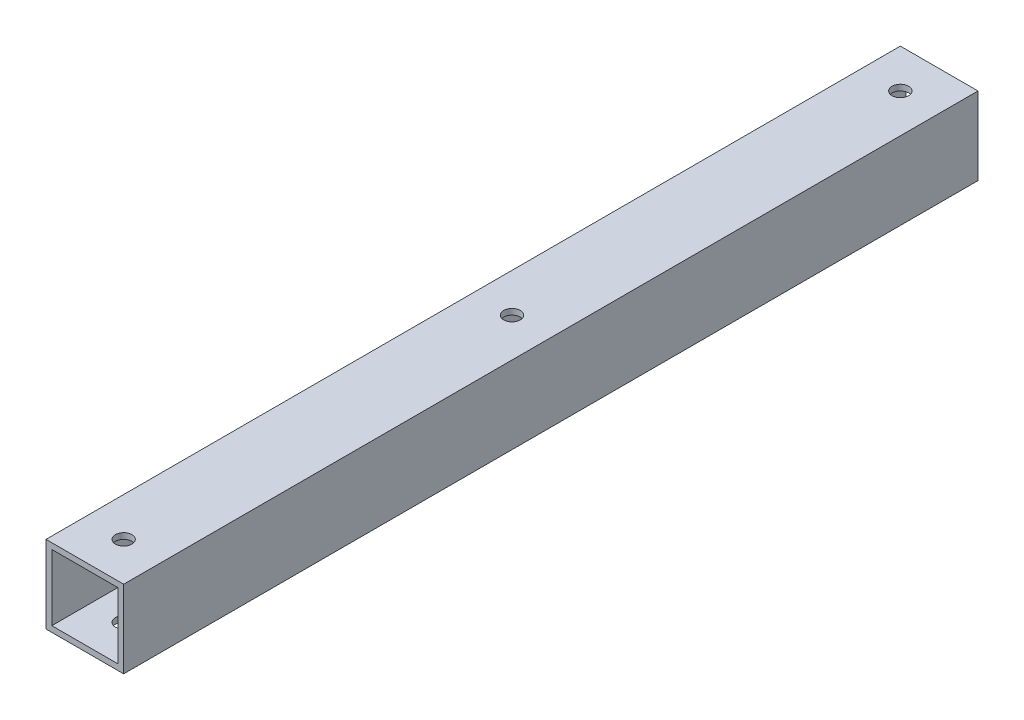
from build123d import *

# Parameters (mm, degrees)
SKETCH1_W           = 20
SKETCH1_H           = 20
SKETCH1_W_2         = 17
SKETCH1_H_2         = 17
BOSS_EXTRUDE1_DEPTH = 220
SKETCH2_R           = 2.125
CUT_EXTRUDE1_DEPTH  = 222.133443875


with BuildPart() as part:
    # Sketch1 → Boss-Extrude1 (new body)
    with BuildSketch(Plane.XY):
        Rectangle(SKETCH1_W, SKETCH1_H)
        Rectangle(SKETCH1_W_2, SKETCH1_H_2, mode=Mode.SUBTRACT)
    extrude(amount=-BOSS_EXTRUDE1_DEPTH)

    # Sketch2 → Cut-Extrude1 (cut, through all)
    with BuildSketch(Plane(origin=(0, 10, 0), x_dir=(1, 0, 0), z_dir=(0, 1, 0))):
        with Locations((0, 10)):
            Circle(SKETCH2_R)
        with Locations((0, 110)):
            Circle(SKETCH2_R)
        with Locations((0, 210)):
            Circle(SKETCH2_R)
    extrude(amount=-CUT_EXTRUDE1_DEPTH, mode=Mode.SUBTRACT)


solid = part.part
